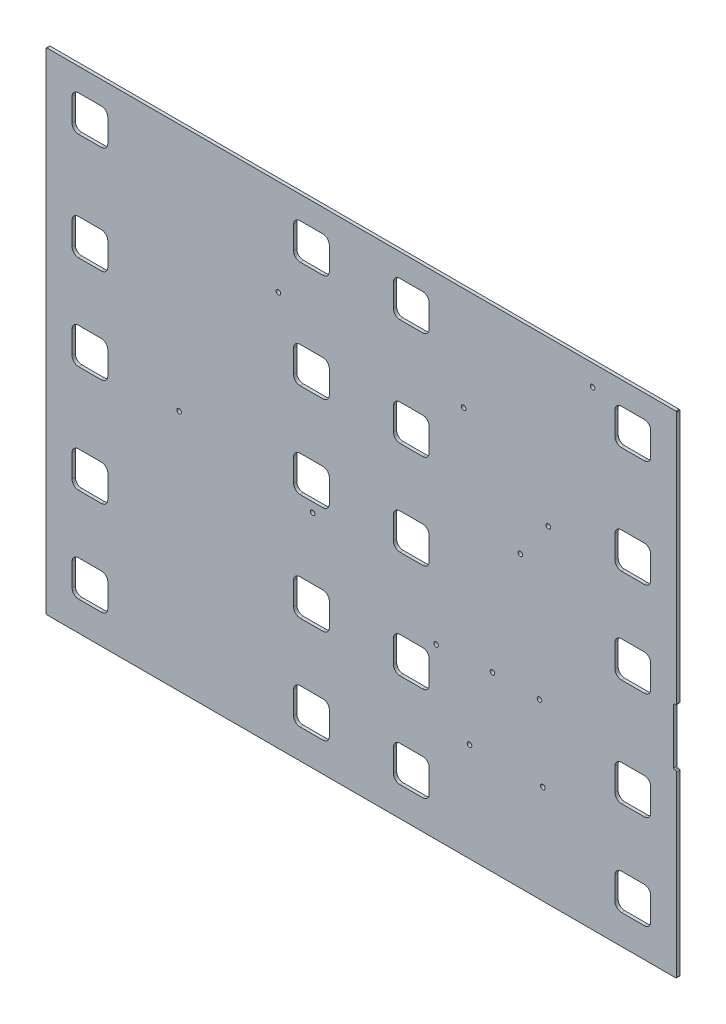
from build123d import *

# Parameters (mm, degrees)
BOSS_EXTRUDE2_DEPTH  = 3.175
CUT_EXTRUDE6_DEPTH   = 569.257427188
LPATTERN2_COUNT      = 2
LPATTERN2_PITCH      = 217.5764
MIRROR1_COPY_1_DEPTH = 569.257427188
CUT_EXTRUDE8_DEPTH   = 569.257427188
M4_CLEARANCE_HOLE1_D = 4.5
FILLET2_R            = 0.79375
FILLET3_R            = 1.016


with BuildPart() as part:
    # Sketch9 → Boss-Extrude2 (new body)
    with BuildSketch(Plane.XY):
        with BuildLine():
            ThreePointArc((475.867292417, 171.345986618), (475.625132776, 171.544437888), (475.426630644, 171.786555837))
            Line((475.426630644, 171.786555837), (-142.918734949, 171.721612037))
            ThreePointArc((-142.918734949, 171.721612037), (-143.117186218, 171.479452396), (-143.359304168, 171.280950264))
            Line((-143.359304168, 171.280950264), (-143.308750051, -310.056816085))
            ThreePointArc((-143.308750051, -310.056816085), (-143.06659041, -310.255267354), (-142.868088278, -310.497385304))
            Line((-142.868088278, -310.497385304), (475.477277315, -310.432441503))
            ThreePointArc((475.477277315, -310.432441503), (475.675728584, -310.190281863), (475.917846534, -309.991779731))
            Line((475.917846534, -309.991779731), (475.867292417, 171.345986618))
        make_face()
    extrude(amount=BOSS_EXTRUDE2_DEPTH)

    # Sketch10 → Cut-Extrude6 (cut, through all)
    with BuildSketch(Plane.XY.offset(3.175)):
        with BuildLine():
            ThreePointArc((-111.536959772, -153.814293782), (-116.026892468, -155.674637302), (-117.886292807, -160.164960677))
            Line((-117.886292807, -160.164960677), (-117.883937231, -182.592960554))
            ThreePointArc((-117.883937231, -182.592960554), (-116.023593711, -187.08289325), (-111.533270336, -188.942293589))
            Line((-111.533270336, -188.942293589), (-89.105270459, -188.939938012))
            ThreePointArc((-89.105270459, -188.939938012), (-84.615337763, -187.079594492), (-82.755937424, -182.589271117))
            Line((-82.755937424, -182.589271117), (-82.758293, -160.161271241))
            ThreePointArc((-82.758293, -160.161271241), (-84.61863652, -155.671338545), (-89.108959895, -153.811938206))
            Line((-89.108959895, -153.811938206), (-111.536959772, -153.814293782))
        make_face()
        with BuildLine():
            ThreePointArc((-111.527235793, -246.397293273), (-116.017168489, -248.257636793), (-117.876568827, -252.747960168))
            Line((-117.876568827, -252.747960168), (-117.874213251, -275.175960044))
            ThreePointArc((-117.874213251, -275.175960044), (-116.013869731, -279.665892741), (-111.523546356, -281.525293079))
            Line((-111.523546356, -281.525293079), (-89.09554648, -281.522937503))
            ThreePointArc((-89.09554648, -281.522937503), (-84.605613784, -279.662593983), (-82.746213445, -275.172270608))
            Line((-82.746213445, -275.172270608), (-82.748569021, -252.744270732))
            ThreePointArc((-82.748569021, -252.744270732), (-84.608912541, -248.254338035), (-89.099235916, -246.394937697))
            Line((-89.099235916, -246.394937697), (-111.527235793, -246.397293273))
        make_face()
        with BuildLine():
            ThreePointArc((-82.769334556, -55.030671822), (-84.629678076, -50.540739126), (-89.120001451, -48.681338787))
            Line((-89.120001451, -48.681338787), (-111.548001328, -48.683694363))
            ThreePointArc((-111.548001328, -48.683694363), (-116.037934024, -50.544037883), (-117.897334363, -55.034361258))
            Line((-117.897334363, -55.034361258), (-117.894978787, -77.462361135))
            ThreePointArc((-117.894978787, -77.462361135), (-116.034635267, -81.952293831), (-111.544311891, -83.81169417))
            Line((-111.544311891, -83.81169417), (-89.116312015, -83.809338593))
            ThreePointArc((-89.116312015, -83.809338593), (-84.626379319, -81.948995073), (-82.76697898, -77.458671698))
            Line((-82.76697898, -77.458671698), (-82.769334556, -55.030671822))
        make_face()
        with BuildLine():
            ThreePointArc((-89.13707755, 113.904260316), (-84.647144854, 115.764603836), (-82.787744515, 120.254927211))
            Line((-82.787744515, 120.254927211), (-82.790100092, 142.682927087))
            ThreePointArc((-82.790100092, 142.682927087), (-84.650443612, 147.172859784), (-89.140766987, 149.032260122))
            Line((-89.140766987, 149.032260122), (-111.568766863, 149.029904546))
            ThreePointArc((-111.568766863, 149.029904546), (-116.058699559, 147.169561026), (-117.918099898, 142.679237651))
            Line((-117.918099898, 142.679237651), (-117.915744322, 120.251237775))
            ThreePointArc((-117.915744322, 120.251237775), (-116.055400802, 115.761305078), (-111.565077427, 113.90190474))
            Line((-111.565077427, 113.90190474), (-89.13707755, 113.904260316))
        make_face()
        with BuildLine():
            ThreePointArc((-117.904702766, 15.120638356), (-116.044359246, 10.630705659), (-111.554035871, 8.771305321))
            Line((-111.554035871, 8.771305321), (-89.126035994, 8.773660897))
            ThreePointArc((-89.126035994, 8.773660897), (-84.636103298, 10.634004417), (-82.77670296, 15.124327792))
            Line((-82.77670296, 15.124327792), (-82.779058536, 37.552327668))
            ThreePointArc((-82.779058536, 37.552327668), (-84.639402056, 42.042260365), (-89.129725431, 43.901660703))
            Line((-89.129725431, 43.901660703), (-111.557725307, 43.899305127))
            ThreePointArc((-111.557725307, 43.899305127), (-116.047658003, 42.038961607), (-117.907058342, 37.548638232))
            Line((-117.907058342, 37.548638232), (-117.904702766, 15.120638356))
        make_face()
    cut_extrude6 = extrude(amount=-CUT_EXTRUDE6_DEPTH, mode=Mode.SUBTRACT)

    # LPattern2: Cut-Extrude6 ×2
    with Locations(*[Vector(0.9999999944845218, 0.00010502836011308041, 0) * (i * LPATTERN2_PITCH) for i in range(1, LPATTERN2_COUNT)]):
        add(cut_extrude6, mode=Mode.SUBTRACT)

    # Mirror1: Cut-Extrude6 across plane
    add(cut_extrude6.mirror(Plane(origin=(166.271985063, 0.017463274, 0), x_dir=(0, 0, 1), z_dir=(-0.9999999944845219, -0.00010502836011320445, 0))), mode=Mode.SUBTRACT)

    # Mirror1 copy 1 sketch → Mirror1 copy 1 (cut, through all)
    with BuildSketch(Plane(origin=(114.967571327, 0.012074856, 3.175), x_dir=(-0.9999999779380877, -0.00021005671906784565, 0), z_dir=(0, 0, 1))):
        with BuildLine():
            ThreePointArc((-111.536959772, 153.814293782), (-116.026892468, 155.674637302), (-117.886292807, 160.164960677))
            Line((-117.886292807, 160.164960677), (-117.883937231, 182.592960554))
            ThreePointArc((-117.883937231, 182.592960554), (-116.023593711, 187.08289325), (-111.533270336, 188.942293589))
            Line((-111.533270336, 188.942293589), (-89.105270459, 188.939938012))
            ThreePointArc((-89.105270459, 188.939938012), (-84.615337763, 187.079594492), (-82.755937424, 182.589271117))
            Line((-82.755937424, 182.589271117), (-82.758293, 160.161271241))
            ThreePointArc((-82.758293, 160.161271241), (-84.61863652, 155.671338545), (-89.108959895, 153.811938206))
            Line((-89.108959895, 153.811938206), (-111.536959772, 153.814293782))
        make_face()
        with BuildLine():
            ThreePointArc((-111.527235793, 246.397293273), (-116.017168489, 248.257636793), (-117.876568827, 252.747960168))
            Line((-117.876568827, 252.747960168), (-117.874213251, 275.175960044))
            ThreePointArc((-117.874213251, 275.175960044), (-116.013869731, 279.665892741), (-111.523546356, 281.525293079))
            Line((-111.523546356, 281.525293079), (-89.09554648, 281.522937503))
            ThreePointArc((-89.09554648, 281.522937503), (-84.605613784, 279.662593983), (-82.746213445, 275.172270608))
            Line((-82.746213445, 275.172270608), (-82.748569021, 252.744270732))
            ThreePointArc((-82.748569021, 252.744270732), (-84.608912541, 248.254338035), (-89.099235916, 246.394937697))
            Line((-89.099235916, 246.394937697), (-111.527235793, 246.397293273))
        make_face()
        with BuildLine():
            ThreePointArc((-82.769334556, 55.030671822), (-84.629678076, 50.540739126), (-89.120001451, 48.681338787))
            Line((-89.120001451, 48.681338787), (-111.548001328, 48.683694363))
            ThreePointArc((-111.548001328, 48.683694363), (-116.037934024, 50.544037883), (-117.897334363, 55.034361258))
            Line((-117.897334363, 55.034361258), (-117.894978787, 77.462361135))
            ThreePointArc((-117.894978787, 77.462361135), (-116.034635267, 81.952293831), (-111.544311891, 83.81169417))
            Line((-111.544311891, 83.81169417), (-89.116312015, 83.809338593))
            ThreePointArc((-89.116312015, 83.809338593), (-84.626379319, 81.948995073), (-82.76697898, 77.458671698))
            Line((-82.76697898, 77.458671698), (-82.769334556, 55.030671822))
        make_face()
        with BuildLine():
            ThreePointArc((-89.13707755, -113.904260316), (-84.647144854, -115.764603836), (-82.787744515, -120.254927211))
            Line((-82.787744515, -120.254927211), (-82.790100092, -142.682927087))
            ThreePointArc((-82.790100092, -142.682927087), (-84.650443612, -147.172859784), (-89.140766987, -149.032260122))
            Line((-89.140766987, -149.032260122), (-111.568766863, -149.029904546))
            ThreePointArc((-111.568766863, -149.029904546), (-116.058699559, -147.169561026), (-117.918099898, -142.679237651))
            Line((-117.918099898, -142.679237651), (-117.915744322, -120.251237775))
            ThreePointArc((-117.915744322, -120.251237775), (-116.055400802, -115.761305078), (-111.565077427, -113.90190474))
            Line((-111.565077427, -113.90190474), (-89.13707755, -113.904260316))
        make_face()
        with BuildLine():
            ThreePointArc((-117.904702766, -15.120638356), (-116.044359246, -10.630705659), (-111.554035871, -8.771305321))
            Line((-111.554035871, -8.771305321), (-89.126035994, -8.773660897))
            ThreePointArc((-89.126035994, -8.773660897), (-84.636103298, -10.634004417), (-82.77670296, -15.124327792))
            Line((-82.77670296, -15.124327792), (-82.779058536, -37.552327668))
            ThreePointArc((-82.779058536, -37.552327668), (-84.639402056, -42.042260365), (-89.129725431, -43.901660703))
            Line((-89.129725431, -43.901660703), (-111.557725307, -43.899305127))
            ThreePointArc((-111.557725307, -43.899305127), (-116.047658003, -42.038961607), (-117.907058342, -37.548638232))
            Line((-117.907058342, -37.548638232), (-117.904702766, -15.120638356))
        make_face()
    extrude(amount=-MIRROR1_COPY_1_DEPTH, mode=Mode.SUBTRACT)

    # Sketch12 → Cut-Extrude8 (cut, through all)
    with BuildSketch(Plane.XY.offset(3.175)):
        Polygon((475.893497013, -78.154204664), (472.960931489, -78.154204664), (472.960931489, -106.094205545), (472.960931489, -134.034204664), (475.899365998, -134.034204664), align=None)
    extrude(amount=-CUT_EXTRUDE8_DEPTH, mode=Mode.SUBTRACT)

    # M4 Clearance Hole1 (through all)
    with Locations(Plane.XY.offset(3.175)):
        with Locations((-12.721209804, -72.402214877), (118.390061764, -93.071344589), (272.495194366, -213.341259843), (344.495193969, -213.333697801), (239.680463229, -144.493605941), (295.022553428, -140.58889343), (341.222553174, -140.58404112), (322.427523958, -26.052005233), (349.923624736, 11.074864309), (266.675399533, 70.342130478), (393.319414118, 151.140432137), (84.813035404, 77.608029812)):
            Hole(M4_CLEARANCE_HOLE1_D / 2)

    # Fillet2
    fillet2_edges = [part.edges().sort_by_distance(p)[0] for p in [
        (-142.868088278, -310.497385304, 1.5875),
        (-143.308750051, -310.056816085, 1.5875),
        (475.477277315, -310.432441503, 1.5875),
        (475.917846534, -309.991779731, 1.5875),
        (475.867292417, 171.345986618, 1.5875),
        (475.426630644, 171.786555837, 1.5875),
        (-142.918734949, 171.721612037, 1.5875),
        (-143.359304168, 171.280950264, 1.5875),
    ]]
    fillet(fillet2_edges, radius=FILLET2_R)

    # Fillet3
    fillet3_edges = [part.edges().sort_by_distance(p)[0] for p in [
        (475.893497013, -78.154204664, 1.5875),
        (472.960931489, -78.154204664, 1.5875),
        (475.899365998, -134.034204664, 1.5875),
        (472.960931489, -134.034204664, 1.5875),
    ]]
    fillet(fillet3_edges, radius=FILLET3_R)


solid = part.part
